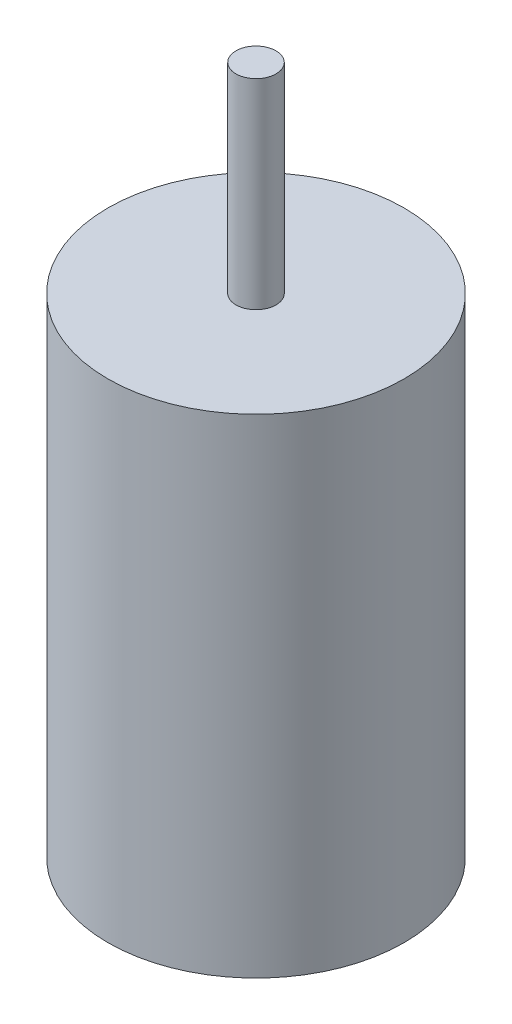
from build123d import *

# Parameters (mm, degrees)
SKETCH1_R           = 18.5
BOSS_EXTRUDE1_DEPTH = 61
SKETCH2_R           = 2.5
BOSS_EXTRUDE2_DEPTH = 25


with BuildPart() as part:
    # Sketch1 → Boss-Extrude1 (new body)
    with BuildSketch(Plane(origin=(0, 0, 0), x_dir=(1, 0, 0), z_dir=(0, 1, 0))):
        Circle(SKETCH1_R)
    extrude(amount=BOSS_EXTRUDE1_DEPTH)

    # Sketch2 → Boss-Extrude2 (add)
    with BuildSketch(Plane(origin=(0, 61, 0), x_dir=(1, 0, 0), z_dir=(0, 1, 0))):
        Circle(SKETCH2_R)
    extrude(amount=BOSS_EXTRUDE2_DEPTH)


solid = part.part
